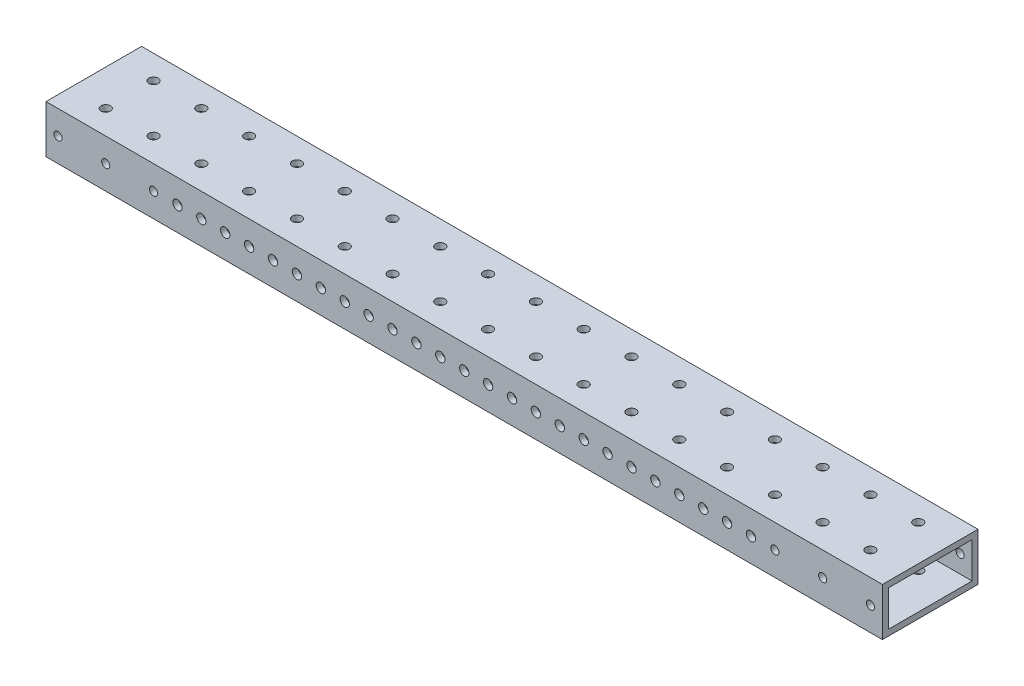
from build123d import *

# Parameters (mm, degrees)
SKETCH1_W           = 50.8
SKETCH1_H           = 25.4
BOSS_EXTRUDE1_DEPTH = 222.25
SHELL1_T            = -3.175
SKETCH2_R           = 2.15265
CUT_EXTRUDE1_DEPTH  = 230.392376726
SKETCH3_R           = 2.4892
CUT_EXTRUDE2_DEPTH  = 230.392376726
LPATTERN1_COUNT     = 25
LPATTERN1_PITCH     = 12.7
SKETCH6_R           = 2.4892
CUT_EXTRUDE3_DEPTH  = 230.392376726
LPATTERN2_COUNT     = 17
LPATTERN2_PITCH     = 25.4


with BuildPart() as part:
    # Sketch1 → Boss-Extrude1 (new, symmetric)
    with BuildSketch(Plane(origin=(0, 0, 0), x_dir=(0, 0, -1), z_dir=(1, 0, 0))):
        with Locations((25.4, 12.7)):
            Rectangle(SKETCH1_W, SKETCH1_H)
    extrude(amount=BOSS_EXTRUDE1_DEPTH, both=True)

    # Shell1
    shell1_openings = [part.faces().sort_by_distance(p)[0] for p in [
        (222.25, 12.7, -25.4),
        (-222.25, 12.7, -25.4),
    ]]
    offset(amount=SHELL1_T, openings=shell1_openings, kind=Kind.INTERSECTION)

    # Sketch2 → Cut-Extrude1 (cut, through all)
    with BuildSketch(Plane.XY):
        with Locations((-215.9, 12.7)):
            Circle(SKETCH2_R)
        with Locations((-190.5, 12.7)):
            Circle(SKETCH2_R)
        with Locations((-165.1, 12.7)):
            Circle(SKETCH2_R)
    cut_extrude1 = extrude(amount=-CUT_EXTRUDE1_DEPTH, mode=Mode.SUBTRACT)

    # Sketch3 → Cut-Extrude2 (cut, through all)
    with BuildSketch(Plane.XY):
        with Locations((-152.4, 12.7)):
            Circle(SKETCH3_R)
    cut_extrude2 = extrude(amount=-CUT_EXTRUDE2_DEPTH, mode=Mode.SUBTRACT)

    # Mirror1: Cut-Extrude1 across plane
    add(cut_extrude1.mirror(Plane(origin=(0, 0, 0), x_dir=(0, 0, 1), z_dir=(1, 0, 0))), mode=Mode.SUBTRACT)

    # LPattern1: Cut-Extrude2 ×25
    with Locations(*[(i * LPATTERN1_PITCH, 0, 0) for i in range(1, LPATTERN1_COUNT)]):
        add(cut_extrude2, mode=Mode.SUBTRACT)

    # Sketch6 → Cut-Extrude3 (cut, through all)
    with BuildSketch(Plane.XZ):
        with Locations((-203.2, -12.7)):
            Circle(SKETCH6_R)
        with Locations((-203.2, -38.1)):
            Circle(SKETCH6_R)
    cut_extrude3 = extrude(amount=-CUT_EXTRUDE3_DEPTH, mode=Mode.SUBTRACT)

    # LPattern2: Cut-Extrude3 ×17
    with Locations(*[(i * LPATTERN2_PITCH, 0, 0) for i in range(1, LPATTERN2_COUNT)]):
        add(cut_extrude3, mode=Mode.SUBTRACT)


solid = part.part
